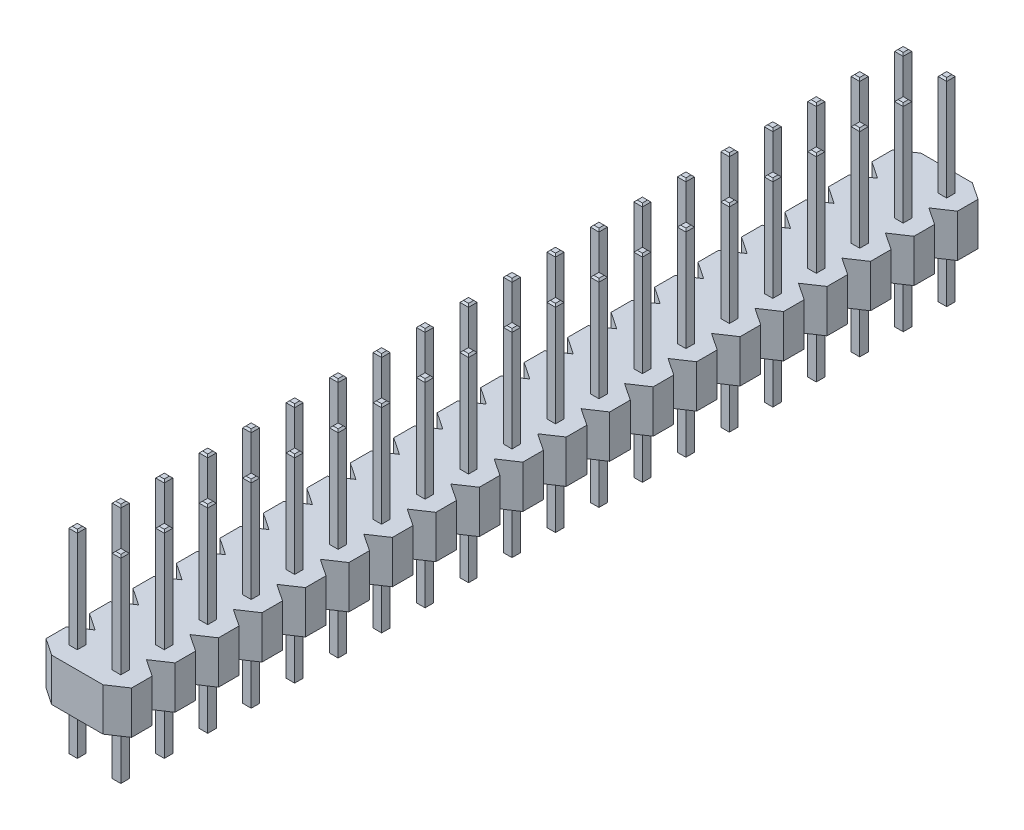
from build123d import *

# Parameters (mm, degrees)
BOSS_EXTRU_1_DEPTH       = 2.5
ENL_V_MAT_EXTRU_1_DEPTH  = 27.903325073
ENL_V_MAT_EXTRU_2_DEPTH  = 27.903325073
ENL_V_MAT_EXTRU_3_DEPTH  = 27.903325073
ENL_V_MAT_EXTRU_4_DEPTH  = 27.903325073
ENL_V_MAT_EXTRU_5_DEPTH  = 27.903325073
ENL_V_MAT_EXTRU_6_DEPTH  = 27.903325073
ENL_V_MAT_EXTRU_7_DEPTH  = 27.903325073
ENL_V_MAT_EXTRU_8_DEPTH  = 27.903325073
ENL_V_MAT_EXTRU_9_DEPTH  = 27.903325073
ENL_V_MAT_EXTRU_10_DEPTH = 27.903325073
ENL_V_MAT_EXTRU_11_DEPTH = 27.903325073
ENL_V_MAT_EXTRU_12_DEPTH = 27.903325073
ENL_V_MAT_EXTRU_13_DEPTH = 27.903325073
ENL_V_MAT_EXTRU_14_DEPTH = 27.903325073
ENL_V_MAT_EXTRU_15_DEPTH = 27.903325073
ENL_V_MAT_EXTRU_16_DEPTH = 27.903325073
ENL_V_MAT_EXTRU_17_DEPTH = 27.903325073
ENL_V_MAT_EXTRU_18_DEPTH = 27.903325073
ENL_V_MAT_EXTRU_19_DEPTH = 27.903325073
ENL_V_MAT_EXTRU_20_DEPTH = 27.903325073
ENL_V_MAT_EXTRU_21_DEPTH = 27.903325073
ENL_V_MAT_EXTRU_22_DEPTH = 27.903325073
ENL_V_MAT_EXTRU_23_DEPTH = 27.903325073
ENL_V_MAT_EXTRU_24_DEPTH = 27.903325073
ENL_V_MAT_EXTRU_25_DEPTH = 27.903325073
ENL_V_MAT_EXTRU_26_DEPTH = 27.903325073
ENL_V_MAT_EXTRU_27_DEPTH = 27.903325073
ENL_V_MAT_EXTRU_28_DEPTH = 27.903325073
ENL_V_MAT_EXTRU_29_DEPTH = 27.903325073
ENL_V_MAT_EXTRU_30_DEPTH = 27.903325073
ENL_V_MAT_EXTRU_31_DEPTH = 27.903325073
ENL_V_MAT_EXTRU_32_DEPTH = 27.903325073
ENL_V_MAT_EXTRU_33_DEPTH = 27.903325073
ENL_V_MAT_EXTRU_34_DEPTH = 27.903325073
ENL_V_MAT_EXTRU_35_DEPTH = 27.903325073
ENL_V_MAT_EXTRU_36_DEPTH = 27.903325073
ENL_V_MAT_EXTRU_37_DEPTH = 27.903325073
ENL_V_MAT_EXTRU_38_DEPTH = 27.903325073
ESQUISSE40_W             = 0.5
ESQUISSE40_H             = 0.5
BOSS_EXTRU_2_DEPTH       = 6
ESQUISSE41_W             = 0.5
ESQUISSE41_H             = 0.5
BOSS_EXTRU_3_DEPTH       = 6
ESQUISSE42_W             = 0.5
ESQUISSE42_H             = 0.5
BOSS_EXTRU_4_DEPTH       = 6
ESQUISSE43_W             = 0.5
ESQUISSE43_H             = 0.5
BOSS_EXTRU_5_DEPTH       = 6
ESQUISSE44_W             = 0.5
ESQUISSE44_H             = 0.5
BOSS_EXTRU_6_DEPTH       = 6
ESQUISSE45_W             = 0.5
ESQUISSE45_H             = 0.5
BOSS_EXTRU_7_DEPTH       = 6
ESQUISSE46_W             = 0.5
ESQUISSE46_H             = 0.5
BOSS_EXTRU_8_DEPTH       = 6
ESQUISSE47_W             = 0.5
ESQUISSE47_H             = 0.5
BOSS_EXTRU_9_DEPTH       = 6
ESQUISSE48_W             = 0.5
ESQUISSE48_H             = 0.5
BOSS_EXTRU_10_DEPTH      = 6
ESQUISSE49_W             = 0.5
ESQUISSE49_H             = 0.5
BOSS_EXTRU_11_DEPTH      = 6
ESQUISSE50_W             = 0.5
ESQUISSE50_H             = 0.5
BOSS_EXTRU_12_DEPTH      = 6
ESQUISSE51_W             = 0.5
ESQUISSE51_H             = 0.5
BOSS_EXTRU_13_DEPTH      = 6
ESQUISSE52_W             = 0.5
ESQUISSE52_H             = 0.5
BOSS_EXTRU_14_DEPTH      = 6
ESQUISSE53_W             = 0.5
ESQUISSE53_H             = 0.5
BOSS_EXTRU_15_DEPTH      = 6
ESQUISSE54_W             = 0.5
ESQUISSE54_H             = 0.5
BOSS_EXTRU_16_DEPTH      = 6
ESQUISSE55_W             = 0.5
ESQUISSE55_H             = 0.5
BOSS_EXTRU_17_DEPTH      = 6
ESQUISSE56_W             = 0.5
ESQUISSE56_H             = 0.5
BOSS_EXTRU_18_DEPTH      = 6
ESQUISSE57_W             = 0.5
ESQUISSE57_H             = 0.5
BOSS_EXTRU_19_DEPTH      = 6
ESQUISSE58_W             = 0.5
ESQUISSE58_H             = 0.5
BOSS_EXTRU_20_DEPTH      = 6
ESQUISSE59_W             = 0.5
ESQUISSE59_H             = 0.5
BOSS_EXTRU_21_DEPTH      = 6
ESQUISSE60_W             = 0.5
ESQUISSE60_H             = 0.5
BOSS_EXTRU_22_DEPTH      = 6
ESQUISSE61_W             = 0.5
ESQUISSE61_H             = 0.5
BOSS_EXTRU_23_DEPTH      = 6
ESQUISSE62_W             = 0.5
ESQUISSE62_H             = 0.5
BOSS_EXTRU_24_DEPTH      = 6
ESQUISSE63_W             = 0.5
ESQUISSE63_H             = 0.5
BOSS_EXTRU_25_DEPTH      = 6
ESQUISSE64_W             = 0.5
ESQUISSE64_H             = 0.5
BOSS_EXTRU_26_DEPTH      = 6
ESQUISSE65_W             = 0.5
ESQUISSE65_H             = 0.5
BOSS_EXTRU_27_DEPTH      = 6
ESQUISSE66_W             = 0.5
ESQUISSE66_H             = 0.5
BOSS_EXTRU_28_DEPTH      = 6
ESQUISSE67_W             = 0.5
ESQUISSE67_H             = 0.5
BOSS_EXTRU_29_DEPTH      = 6
ESQUISSE68_W             = 0.5
ESQUISSE68_H             = 0.5
BOSS_EXTRU_30_DEPTH      = 6
ESQUISSE69_W             = 0.5
ESQUISSE69_H             = 0.5
BOSS_EXTRU_31_DEPTH      = 6
ESQUISSE70_W             = 0.5
ESQUISSE70_H             = 0.5
BOSS_EXTRU_32_DEPTH      = 6
ESQUISSE71_W             = 0.5
ESQUISSE71_H             = 0.5
BOSS_EXTRU_33_DEPTH      = 6
ESQUISSE72_W             = 0.5
ESQUISSE72_H             = 0.5
BOSS_EXTRU_34_DEPTH      = 6
ESQUISSE73_W             = 0.5
ESQUISSE73_H             = 0.5
BOSS_EXTRU_35_DEPTH      = 6
ESQUISSE74_W             = 0.5
ESQUISSE74_H             = 0.5
BOSS_EXTRU_36_DEPTH      = 6
ESQUISSE75_W             = 0.5
ESQUISSE75_H             = 0.5
BOSS_EXTRU_37_DEPTH      = 6
ESQUISSE76_W             = 0.5
ESQUISSE76_H             = 0.5
BOSS_EXTRU_38_DEPTH      = 6
ESQUISSE77_W             = 0.5
ESQUISSE77_H             = 0.5
BOSS_EXTRU_39_DEPTH      = 6
ESQUISSE78_W             = 0.5
ESQUISSE78_H             = 0.5
BOSS_EXTRU_40_DEPTH      = 6
ESQUISSE79_W             = 0.5
ESQUISSE79_H             = 0.5
BOSS_EXTRU_41_DEPTH      = 6
ESQUISSE80_W             = 0.5
ESQUISSE80_H             = 0.5
BOSS_EXTRU_42_DEPTH      = 3
ESQUISSE81_W             = 0.5
ESQUISSE81_H             = 0.5
BOSS_EXTRU_43_DEPTH      = 3
ESQUISSE82_W             = 0.5
ESQUISSE82_H             = 0.5
BOSS_EXTRU_44_DEPTH      = 3
ESQUISSE83_W             = 0.5
ESQUISSE83_H             = 0.5
BOSS_EXTRU_45_DEPTH      = 3
ESQUISSE84_W             = 0.5
ESQUISSE84_H             = 0.5
BOSS_EXTRU_46_DEPTH      = 3
ESQUISSE85_W             = 0.5
ESQUISSE85_H             = 0.5
BOSS_EXTRU_47_DEPTH      = 3
ESQUISSE86_W             = 0.5
ESQUISSE86_H             = 0.5
BOSS_EXTRU_48_DEPTH      = 3
ESQUISSE87_W             = 0.5
ESQUISSE87_H             = 0.5
BOSS_EXTRU_49_DEPTH      = 3
ESQUISSE88_W             = 0.5
ESQUISSE88_H             = 0.5
BOSS_EXTRU_50_DEPTH      = 3
ESQUISSE89_W             = 0.5
ESQUISSE89_H             = 0.5
BOSS_EXTRU_51_DEPTH      = 3
ESQUISSE90_W             = 0.5
ESQUISSE90_H             = 0.5
BOSS_EXTRU_52_DEPTH      = 3
ESQUISSE91_W             = 0.5
ESQUISSE91_H             = 0.5
BOSS_EXTRU_53_DEPTH      = 3
ESQUISSE92_W             = 0.5
ESQUISSE92_H             = 0.5
BOSS_EXTRU_54_DEPTH      = 3
ESQUISSE93_W             = 0.5
ESQUISSE93_H             = 0.5
BOSS_EXTRU_55_DEPTH      = 3
ESQUISSE94_W             = 0.5
ESQUISSE94_H             = 0.5
BOSS_EXTRU_56_DEPTH      = 3
ESQUISSE95_W             = 0.5
ESQUISSE95_H             = 0.5
BOSS_EXTRU_57_DEPTH      = 3
ESQUISSE96_W             = 0.5
ESQUISSE96_H             = 0.5
BOSS_EXTRU_58_DEPTH      = 3
ESQUISSE97_W             = 0.5
ESQUISSE97_H             = 0.5
BOSS_EXTRU_59_DEPTH      = 3
ESQUISSE98_W             = 0.5
ESQUISSE98_H             = 0.5
BOSS_EXTRU_60_DEPTH      = 3
ESQUISSE99_W             = 0.5
ESQUISSE99_H             = 0.5
BOSS_EXTRU_61_DEPTH      = 3
ESQUISSE100_W            = 0.5
ESQUISSE100_H            = 0.5
BOSS_EXTRU_62_DEPTH      = 3
ESQUISSE101_W            = 0.5
ESQUISSE101_H            = 0.5
BOSS_EXTRU_63_DEPTH      = 3
ESQUISSE102_W            = 0.5
ESQUISSE102_H            = 0.5
BOSS_EXTRU_64_DEPTH      = 3
ESQUISSE103_W            = 0.5
ESQUISSE103_H            = 0.5
BOSS_EXTRU_65_DEPTH      = 3
ESQUISSE104_W            = 0.5
ESQUISSE104_H            = 0.5
BOSS_EXTRU_66_DEPTH      = 3
ESQUISSE105_W            = 0.5
ESQUISSE105_H            = 0.5
BOSS_EXTRU_67_DEPTH      = 3
ESQUISSE106_W            = 0.5
ESQUISSE106_H            = 0.5
BOSS_EXTRU_68_DEPTH      = 3
ESQUISSE107_W            = 0.5
ESQUISSE107_H            = 0.5
BOSS_EXTRU_69_DEPTH      = 3
ESQUISSE108_W            = 0.5
ESQUISSE108_H            = 0.5
BOSS_EXTRU_70_DEPTH      = 3
ESQUISSE109_W            = 0.5
ESQUISSE109_H            = 0.5
BOSS_EXTRU_71_DEPTH      = 3
ESQUISSE110_W            = 0.5
ESQUISSE110_H            = 0.5
BOSS_EXTRU_72_DEPTH      = 3
ESQUISSE111_W            = 0.5
ESQUISSE111_H            = 0.5
BOSS_EXTRU_73_DEPTH      = 3
ESQUISSE112_W            = 0.5
ESQUISSE112_H            = 0.5
BOSS_EXTRU_74_DEPTH      = 3
ESQUISSE113_W            = 0.5
ESQUISSE113_H            = 0.5
BOSS_EXTRU_75_DEPTH      = 3
ESQUISSE114_W            = 0.5
ESQUISSE114_H            = 0.5
BOSS_EXTRU_76_DEPTH      = 3
ESQUISSE115_W            = 0.5
ESQUISSE115_H            = 0.5
BOSS_EXTRU_77_DEPTH      = 3
ESQUISSE116_W            = 0.5
ESQUISSE116_H            = 0.5
BOSS_EXTRU_78_DEPTH      = 3
ESQUISSE117_W            = 0.5
ESQUISSE117_H            = 0.5
BOSS_EXTRU_79_DEPTH      = 3
ESQUISSE118_W            = 0.5
ESQUISSE118_H            = 0.5
BOSS_EXTRU_80_DEPTH      = 3
ESQUISSE119_W            = 0.5
ESQUISSE119_H            = 0.5
BOSS_EXTRU_81_DEPTH      = 3
CHANFREIN1_SIZE          = 0.1


with BuildPart() as part:
    # Esquisse1 → Boss.-Extru.1 (new body)
    with BuildSketch(Plane(origin=(0, 2.5, 0), x_dir=(1, 0, 0), z_dir=(0, 1, 0))):
        Polygon((2.5, -23.46), (2.5, 26), (1.5, 26.67), (-1.5, 26.67), (-2.5, 26), (-2.5, -23.46), (-1.5, -24.13), (1.5, -24.13), align=None)
    extrude(amount=-BOSS_EXTRU_1_DEPTH)

    # Esquisse2 → Enlèv. mat.-Extru.1 (cut, through all)
    with BuildSketch(Plane.XZ):
        Polygon((-2.5, 7.02), (-2.5, 5.68), (-1.5, 6.35), align=None)
    extrude(amount=-ENL_V_MAT_EXTRU_1_DEPTH, mode=Mode.SUBTRACT)

    # Esquisse3 → Enlèv. mat.-Extru.2 (cut, through all)
    with BuildSketch(Plane.XZ):
        Polygon((-2.5, 9.56), (-2.5, 8.22), (-1.5, 8.89), align=None)
    extrude(amount=-ENL_V_MAT_EXTRU_2_DEPTH, mode=Mode.SUBTRACT)

    # Esquisse4 → Enlèv. mat.-Extru.3 (cut, through all)
    with BuildSketch(Plane.XZ):
        Polygon((-2.5, 12.1), (-2.5, 10.76), (-1.5, 11.43), align=None)
    extrude(amount=-ENL_V_MAT_EXTRU_3_DEPTH, mode=Mode.SUBTRACT)

    # Esquisse5 → Enlèv. mat.-Extru.4 (cut, through all)
    with BuildSketch(Plane.XZ):
        Polygon((-2.5, 14.64), (-2.5, 13.3), (-1.5, 13.97), align=None)
    extrude(amount=-ENL_V_MAT_EXTRU_4_DEPTH, mode=Mode.SUBTRACT)

    # Esquisse6 → Enlèv. mat.-Extru.5 (cut, through all)
    with BuildSketch(Plane.XZ):
        Polygon((-2.5, 17.18), (-2.5, 15.84), (-1.5, 16.51), align=None)
    extrude(amount=-ENL_V_MAT_EXTRU_5_DEPTH, mode=Mode.SUBTRACT)

    # Esquisse7 → Enlèv. mat.-Extru.6 (cut, through all)
    with BuildSketch(Plane.XZ):
        Polygon((-2.5, 19.72), (-2.5, 18.38), (-1.5, 19.05), align=None)
    extrude(amount=-ENL_V_MAT_EXTRU_6_DEPTH, mode=Mode.SUBTRACT)

    # Esquisse8 → Enlèv. mat.-Extru.7 (cut, through all)
    with BuildSketch(Plane.XZ):
        Polygon((-2.5, 22.26), (-2.5, 20.92), (-1.5, 21.59), align=None)
    extrude(amount=-ENL_V_MAT_EXTRU_7_DEPTH, mode=Mode.SUBTRACT)

    # Esquisse9 → Enlèv. mat.-Extru.8 (cut, through all)
    with BuildSketch(Plane.XZ):
        Polygon((2.5, 20.92), (2.5, 22.26), (1.5, 21.59), align=None)
    extrude(amount=-ENL_V_MAT_EXTRU_8_DEPTH, mode=Mode.SUBTRACT)

    # Esquisse10 → Enlèv. mat.-Extru.9 (cut, through all)
    with BuildSketch(Plane.XZ):
        Polygon((2.5, 18.38), (2.5, 19.72), (1.5, 19.05), align=None)
    extrude(amount=-ENL_V_MAT_EXTRU_9_DEPTH, mode=Mode.SUBTRACT)

    # Esquisse11 → Enlèv. mat.-Extru.10 (cut, through all)
    with BuildSketch(Plane.XZ):
        Polygon((2.5, 15.84), (2.5, 17.18), (1.5, 16.51), align=None)
    extrude(amount=-ENL_V_MAT_EXTRU_10_DEPTH, mode=Mode.SUBTRACT)

    # Esquisse12 → Enlèv. mat.-Extru.11 (cut, through all)
    with BuildSketch(Plane.XZ):
        Polygon((2.5, 13.3), (2.5, 14.64), (1.5, 13.97), align=None)
    extrude(amount=-ENL_V_MAT_EXTRU_11_DEPTH, mode=Mode.SUBTRACT)

    # Esquisse13 → Enlèv. mat.-Extru.12 (cut, through all)
    with BuildSketch(Plane.XZ):
        Polygon((2.5, 10.76), (2.5, 12.1), (1.5, 11.43), align=None)
    extrude(amount=-ENL_V_MAT_EXTRU_12_DEPTH, mode=Mode.SUBTRACT)

    # Esquisse14 → Enlèv. mat.-Extru.13 (cut, through all)
    with BuildSketch(Plane.XZ):
        Polygon((2.5, 8.22), (2.5, 9.56), (1.5, 8.89), align=None)
    extrude(amount=-ENL_V_MAT_EXTRU_13_DEPTH, mode=Mode.SUBTRACT)

    # Esquisse15 → Enlèv. mat.-Extru.14 (cut, through all)
    with BuildSketch(Plane.XZ):
        Polygon((2.5, 5.68), (2.5, 7.02), (1.5, 6.35), align=None)
    extrude(amount=-ENL_V_MAT_EXTRU_14_DEPTH, mode=Mode.SUBTRACT)

    # Esquisse16 → Enlèv. mat.-Extru.15 (cut, through all)
    with BuildSketch(Plane.XZ):
        Polygon((2.5, 3.14), (2.5, 4.48), (1.5, 3.81), align=None)
    extrude(amount=-ENL_V_MAT_EXTRU_15_DEPTH, mode=Mode.SUBTRACT)

    # Esquisse17 → Enlèv. mat.-Extru.16 (cut, through all)
    with BuildSketch(Plane.XZ):
        Polygon((2.5, 0.6), (2.5, 1.94), (1.5, 1.27), align=None)
    extrude(amount=-ENL_V_MAT_EXTRU_16_DEPTH, mode=Mode.SUBTRACT)

    # Esquisse18 → Enlèv. mat.-Extru.17 (cut, through all)
    with BuildSketch(Plane.XZ):
        Polygon((2.5, -1.94), (2.5, -0.6), (1.5, -1.27), align=None)
    extrude(amount=-ENL_V_MAT_EXTRU_17_DEPTH, mode=Mode.SUBTRACT)

    # Esquisse19 → Enlèv. mat.-Extru.18 (cut, through all)
    with BuildSketch(Plane.XZ):
        Polygon((2.5, -4.48), (2.5, -3.14), (1.5, -3.81), align=None)
    extrude(amount=-ENL_V_MAT_EXTRU_18_DEPTH, mode=Mode.SUBTRACT)

    # Esquisse20 → Enlèv. mat.-Extru.19 (cut, through all)
    with BuildSketch(Plane.XZ):
        Polygon((2.5, -7.02), (2.5, -5.68), (1.5, -6.35), align=None)
    extrude(amount=-ENL_V_MAT_EXTRU_19_DEPTH, mode=Mode.SUBTRACT)

    # Esquisse21 → Enlèv. mat.-Extru.20 (cut, through all)
    with BuildSketch(Plane.XZ):
        Polygon((2.5, -9.56), (2.5, -8.22), (1.5, -8.89), align=None)
    extrude(amount=-ENL_V_MAT_EXTRU_20_DEPTH, mode=Mode.SUBTRACT)

    # Esquisse22 → Enlèv. mat.-Extru.21 (cut, through all)
    with BuildSketch(Plane.XZ):
        Polygon((2.5, -12.1), (2.5, -10.76), (1.5, -11.43), align=None)
    extrude(amount=-ENL_V_MAT_EXTRU_21_DEPTH, mode=Mode.SUBTRACT)

    # Esquisse23 → Enlèv. mat.-Extru.22 (cut, through all)
    with BuildSketch(Plane.XZ):
        Polygon((2.5, -14.64), (2.5, -13.3), (1.5, -13.97), align=None)
    extrude(amount=-ENL_V_MAT_EXTRU_22_DEPTH, mode=Mode.SUBTRACT)

    # Esquisse24 → Enlèv. mat.-Extru.23 (cut, through all)
    with BuildSketch(Plane.XZ):
        Polygon((2.5, -17.18), (2.5, -15.84), (1.5, -16.51), align=None)
    extrude(amount=-ENL_V_MAT_EXTRU_23_DEPTH, mode=Mode.SUBTRACT)

    # Esquisse25 → Enlèv. mat.-Extru.24 (cut, through all)
    with BuildSketch(Plane.XZ):
        Polygon((2.5, -19.72), (2.5, -18.38), (1.5, -19.05), align=None)
    extrude(amount=-ENL_V_MAT_EXTRU_24_DEPTH, mode=Mode.SUBTRACT)

    # Esquisse26 → Enlèv. mat.-Extru.25 (cut, through all)
    with BuildSketch(Plane.XZ):
        Polygon((2.5, -22.26), (2.5, -20.92), (1.5, -21.59), align=None)
    extrude(amount=-ENL_V_MAT_EXTRU_25_DEPTH, mode=Mode.SUBTRACT)

    # Esquisse27 → Enlèv. mat.-Extru.26 (cut, through all)
    with BuildSketch(Plane.XZ):
        Polygon((2.5, -24.8), (2.5, -23.46), (1.5, -24.13), align=None)
    extrude(amount=-ENL_V_MAT_EXTRU_26_DEPTH, mode=Mode.SUBTRACT)

    # Esquisse28 → Enlèv. mat.-Extru.27 (cut, through all)
    with BuildSketch(Plane.XZ):
        Polygon((-2.5, -23.46), (-2.5, -24.8), (-1.5, -24.13), align=None)
    extrude(amount=-ENL_V_MAT_EXTRU_27_DEPTH, mode=Mode.SUBTRACT)

    # Esquisse29 → Enlèv. mat.-Extru.28 (cut, through all)
    with BuildSketch(Plane.XZ):
        Polygon((-2.5, -20.92), (-2.5, -22.26), (-1.5, -21.59), align=None)
    extrude(amount=-ENL_V_MAT_EXTRU_28_DEPTH, mode=Mode.SUBTRACT)

    # Esquisse30 → Enlèv. mat.-Extru.29 (cut, through all)
    with BuildSketch(Plane.XZ):
        Polygon((-2.5, -18.38), (-2.5, -19.72), (-1.5, -19.05), align=None)
    extrude(amount=-ENL_V_MAT_EXTRU_29_DEPTH, mode=Mode.SUBTRACT)

    # Esquisse31 → Enlèv. mat.-Extru.30 (cut, through all)
    with BuildSketch(Plane.XZ):
        Polygon((-2.5, -15.84), (-2.5, -17.18), (-1.5, -16.51), align=None)
    extrude(amount=-ENL_V_MAT_EXTRU_30_DEPTH, mode=Mode.SUBTRACT)

    # Esquisse32 → Enlèv. mat.-Extru.31 (cut, through all)
    with BuildSketch(Plane.XZ):
        Polygon((-2.5, -13.3), (-2.5, -14.64), (-1.5, -13.97), align=None)
    extrude(amount=-ENL_V_MAT_EXTRU_31_DEPTH, mode=Mode.SUBTRACT)

    # Esquisse33 → Enlèv. mat.-Extru.32 (cut, through all)
    with BuildSketch(Plane.XZ):
        Polygon((-2.5, -10.76), (-2.5, -12.1), (-1.5, -11.43), align=None)
    extrude(amount=-ENL_V_MAT_EXTRU_32_DEPTH, mode=Mode.SUBTRACT)

    # Esquisse34 → Enlèv. mat.-Extru.33 (cut, through all)
    with BuildSketch(Plane.XZ):
        Polygon((-2.5, -8.22), (-2.5, -9.56), (-1.5, -8.89), align=None)
    extrude(amount=-ENL_V_MAT_EXTRU_33_DEPTH, mode=Mode.SUBTRACT)

    # Esquisse35 → Enlèv. mat.-Extru.34 (cut, through all)
    with BuildSketch(Plane.XZ):
        Polygon((-2.5, -5.68), (-2.5, -7.02), (-1.5, -6.35), align=None)
    extrude(amount=-ENL_V_MAT_EXTRU_34_DEPTH, mode=Mode.SUBTRACT)

    # Esquisse36 → Enlèv. mat.-Extru.35 (cut, through all)
    with BuildSketch(Plane.XZ):
        Polygon((-2.5, -3.14), (-2.5, -4.48), (-1.5, -3.81), align=None)
    extrude(amount=-ENL_V_MAT_EXTRU_35_DEPTH, mode=Mode.SUBTRACT)

    # Esquisse37 → Enlèv. mat.-Extru.36 (cut, through all)
    with BuildSketch(Plane.XZ):
        Polygon((-2.5, -0.6), (-2.5, -1.94), (-1.5, -1.27), align=None)
    extrude(amount=-ENL_V_MAT_EXTRU_36_DEPTH, mode=Mode.SUBTRACT)

    # Esquisse38 → Enlèv. mat.-Extru.37 (cut, through all)
    with BuildSketch(Plane.XZ):
        Polygon((-2.5, 1.94), (-2.5, 0.6), (-1.5, 1.27), align=None)
    extrude(amount=-ENL_V_MAT_EXTRU_37_DEPTH, mode=Mode.SUBTRACT)

    # Esquisse39 → Enlèv. mat.-Extru.38 (cut, through all)
    with BuildSketch(Plane.XZ):
        Polygon((-2.5, 4.48), (-2.5, 3.14), (-1.5, 3.81), align=None)
    extrude(amount=-ENL_V_MAT_EXTRU_38_DEPTH, mode=Mode.SUBTRACT)

    # Esquisse40 → Boss.-Extru.2 (add)
    with BuildSketch(Plane(origin=(0, 2.5, 0), x_dir=(-1, 0, 0), z_dir=(0, 1, 0))):
        with Locations((1.27, -2.54)):
            Rectangle(ESQUISSE40_W, ESQUISSE40_H)
    extrude(amount=BOSS_EXTRU_2_DEPTH)

    # Esquisse41 → Boss.-Extru.3 (add)
    with BuildSketch(Plane(origin=(0, 2.5, 0), x_dir=(-1, 0, 0), z_dir=(0, 1, 0))):
        with Locations((-1.27, -2.54)):
            Rectangle(ESQUISSE41_W, ESQUISSE41_H)
    extrude(amount=BOSS_EXTRU_3_DEPTH)

    # Esquisse42 → Boss.-Extru.4 (add)
    with BuildSketch(Plane(origin=(0, 2.5, 0), x_dir=(-1, 0, 0), z_dir=(0, 1, 0))):
        with Locations((-1.27, -5.08)):
            Rectangle(ESQUISSE42_W, ESQUISSE42_H)
    extrude(amount=BOSS_EXTRU_4_DEPTH)

    # Esquisse43 → Boss.-Extru.5 (add)
    with BuildSketch(Plane(origin=(0, 2.5, 0), x_dir=(-1, 0, 0), z_dir=(0, 1, 0))):
        with Locations((1.27, -5.08)):
            Rectangle(ESQUISSE43_W, ESQUISSE43_H)
    extrude(amount=BOSS_EXTRU_5_DEPTH)

    # Esquisse44 → Boss.-Extru.6 (add)
    with BuildSketch(Plane(origin=(0, 2.5, 0), x_dir=(-1, 0, 0), z_dir=(0, 1, 0))):
        with Locations((-1.27, -7.62)):
            Rectangle(ESQUISSE44_W, ESQUISSE44_H)
    extrude(amount=BOSS_EXTRU_6_DEPTH)

    # Esquisse45 → Boss.-Extru.7 (add)
    with BuildSketch(Plane(origin=(0, 2.5, 0), x_dir=(-1, 0, 0), z_dir=(0, 1, 0))):
        with Locations((1.27, -7.62)):
            Rectangle(ESQUISSE45_W, ESQUISSE45_H)
    extrude(amount=BOSS_EXTRU_7_DEPTH)

    # Esquisse46 → Boss.-Extru.8 (add)
    with BuildSketch(Plane(origin=(0, 2.5, 0), x_dir=(-1, 0, 0), z_dir=(0, 1, 0))):
        with Locations((-1.27, -10.16)):
            Rectangle(ESQUISSE46_W, ESQUISSE46_H)
    extrude(amount=BOSS_EXTRU_8_DEPTH)

    # Esquisse47 → Boss.-Extru.9 (add)
    with BuildSketch(Plane(origin=(0, 2.5, 0), x_dir=(-1, 0, 0), z_dir=(0, 1, 0))):
        with Locations((1.27, -10.16)):
            Rectangle(ESQUISSE47_W, ESQUISSE47_H)
    extrude(amount=BOSS_EXTRU_9_DEPTH)

    # Esquisse48 → Boss.-Extru.10 (add)
    with BuildSketch(Plane(origin=(0, 2.5, 0), x_dir=(-1, 0, 0), z_dir=(0, 1, 0))):
        with Locations((-1.27, -12.7)):
            Rectangle(ESQUISSE48_W, ESQUISSE48_H)
    extrude(amount=BOSS_EXTRU_10_DEPTH)

    # Esquisse49 → Boss.-Extru.11 (add)
    with BuildSketch(Plane(origin=(0, 2.5, 0), x_dir=(-1, 0, 0), z_dir=(0, 1, 0))):
        with Locations((1.27, -12.7)):
            Rectangle(ESQUISSE49_W, ESQUISSE49_H)
    extrude(amount=BOSS_EXTRU_11_DEPTH)

    # Esquisse50 → Boss.-Extru.12 (add)
    with BuildSketch(Plane(origin=(0, 2.5, 0), x_dir=(-1, 0, 0), z_dir=(0, 1, 0))):
        with Locations((-1.27, -15.24)):
            Rectangle(ESQUISSE50_W, ESQUISSE50_H)
    extrude(amount=BOSS_EXTRU_12_DEPTH)

    # Esquisse51 → Boss.-Extru.13 (add)
    with BuildSketch(Plane(origin=(0, 2.5, 0), x_dir=(-1, 0, 0), z_dir=(0, 1, 0))):
        with Locations((1.27, -15.24)):
            Rectangle(ESQUISSE51_W, ESQUISSE51_H)
    extrude(amount=BOSS_EXTRU_13_DEPTH)

    # Esquisse52 → Boss.-Extru.14 (add)
    with BuildSketch(Plane(origin=(0, 2.5, 0), x_dir=(-1, 0, 0), z_dir=(0, 1, 0))):
        with Locations((-1.27, -17.78)):
            Rectangle(ESQUISSE52_W, ESQUISSE52_H)
    extrude(amount=BOSS_EXTRU_14_DEPTH)

    # Esquisse53 → Boss.-Extru.15 (add)
    with BuildSketch(Plane(origin=(0, 2.5, 0), x_dir=(-1, 0, 0), z_dir=(0, 1, 0))):
        with Locations((1.27, -17.78)):
            Rectangle(ESQUISSE53_W, ESQUISSE53_H)
    extrude(amount=BOSS_EXTRU_15_DEPTH)

    # Esquisse54 → Boss.-Extru.16 (add)
    with BuildSketch(Plane(origin=(0, 2.5, 0), x_dir=(-1, 0, 0), z_dir=(0, 1, 0))):
        with Locations((-1.27, -20.32)):
            Rectangle(ESQUISSE54_W, ESQUISSE54_H)
    extrude(amount=BOSS_EXTRU_16_DEPTH)

    # Esquisse55 → Boss.-Extru.17 (add)
    with BuildSketch(Plane(origin=(0, 2.5, 0), x_dir=(-1, 0, 0), z_dir=(0, 1, 0))):
        with Locations((1.27, -20.32)):
            Rectangle(ESQUISSE55_W, ESQUISSE55_H)
    extrude(amount=BOSS_EXTRU_17_DEPTH)

    # Esquisse56 → Boss.-Extru.18 (add)
    with BuildSketch(Plane(origin=(0, 2.5, 0), x_dir=(-1, 0, 0), z_dir=(0, 1, 0))):
        with Locations((-1.27, -22.86)):
            Rectangle(ESQUISSE56_W, ESQUISSE56_H)
    extrude(amount=BOSS_EXTRU_18_DEPTH)

    # Esquisse57 → Boss.-Extru.19 (add)
    with BuildSketch(Plane(origin=(0, 2.5, 0), x_dir=(-1, 0, 0), z_dir=(0, 1, 0))):
        with Locations((1.27, -22.86)):
            Rectangle(ESQUISSE57_W, ESQUISSE57_H)
    extrude(amount=BOSS_EXTRU_19_DEPTH)

    # Esquisse58 → Boss.-Extru.20 (add)
    with BuildSketch(Plane(origin=(0, 2.5, 0), x_dir=(-1, 0, 0), z_dir=(0, 1, 0))):
        with Locations((-1.27, -25.4)):
            Rectangle(ESQUISSE58_W, ESQUISSE58_H)
    extrude(amount=BOSS_EXTRU_20_DEPTH)

    # Esquisse59 → Boss.-Extru.21 (add)
    with BuildSketch(Plane(origin=(0, 2.5, 0), x_dir=(-1, 0, 0), z_dir=(0, 1, 0))):
        with Locations((1.27, -25.4)):
            Rectangle(ESQUISSE59_W, ESQUISSE59_H)
    extrude(amount=BOSS_EXTRU_21_DEPTH)

    # Esquisse60 → Boss.-Extru.22 (add)
    with BuildSketch(Plane(origin=(0, 2.5, 0), x_dir=(-1, 0, 0), z_dir=(0, 1, 0))):
        with Locations((1.27, 22.86)):
            Rectangle(ESQUISSE60_W, ESQUISSE60_H)
    extrude(amount=BOSS_EXTRU_22_DEPTH)

    # Esquisse61 → Boss.-Extru.23 (add)
    with BuildSketch(Plane(origin=(0, 2.5, 0), x_dir=(-1, 0, 0), z_dir=(0, 1, 0))):
        with Locations((-1.27, 22.86)):
            Rectangle(ESQUISSE61_W, ESQUISSE61_H)
    extrude(amount=BOSS_EXTRU_23_DEPTH)

    # Esquisse62 → Boss.-Extru.24 (add)
    with BuildSketch(Plane(origin=(0, 2.5, 0), x_dir=(-1, 0, 0), z_dir=(0, 1, 0))):
        with Locations((-1.27, 20.32)):
            Rectangle(ESQUISSE62_W, ESQUISSE62_H)
    extrude(amount=BOSS_EXTRU_24_DEPTH)

    # Esquisse63 → Boss.-Extru.25 (add)
    with BuildSketch(Plane(origin=(0, 2.5, 0), x_dir=(-1, 0, 0), z_dir=(0, 1, 0))):
        with Locations((1.27, 20.32)):
            Rectangle(ESQUISSE63_W, ESQUISSE63_H)
    extrude(amount=BOSS_EXTRU_25_DEPTH)

    # Esquisse64 → Boss.-Extru.26 (add)
    with BuildSketch(Plane(origin=(0, 2.5, 0), x_dir=(-1, 0, 0), z_dir=(0, 1, 0))):
        with Locations((-1.27, 17.78)):
            Rectangle(ESQUISSE64_W, ESQUISSE64_H)
    extrude(amount=BOSS_EXTRU_26_DEPTH)

    # Esquisse65 → Boss.-Extru.27 (add)
    with BuildSketch(Plane(origin=(0, 2.5, 0), x_dir=(-1, 0, 0), z_dir=(0, 1, 0))):
        with Locations((1.27, 17.78)):
            Rectangle(ESQUISSE65_W, ESQUISSE65_H)
    extrude(amount=BOSS_EXTRU_27_DEPTH)

    # Esquisse66 → Boss.-Extru.28 (add)
    with BuildSketch(Plane(origin=(0, 2.5, 0), x_dir=(-1, 0, 0), z_dir=(0, 1, 0))):
        with Locations((-1.27, 15.24)):
            Rectangle(ESQUISSE66_W, ESQUISSE66_H)
    extrude(amount=BOSS_EXTRU_28_DEPTH)

    # Esquisse67 → Boss.-Extru.29 (add)
    with BuildSketch(Plane(origin=(0, 2.5, 0), x_dir=(-1, 0, 0), z_dir=(0, 1, 0))):
        with Locations((1.27, 15.24)):
            Rectangle(ESQUISSE67_W, ESQUISSE67_H)
    extrude(amount=BOSS_EXTRU_29_DEPTH)

    # Esquisse68 → Boss.-Extru.30 (add)
    with BuildSketch(Plane(origin=(0, 2.5, 0), x_dir=(-1, 0, 0), z_dir=(0, 1, 0))):
        with Locations((-1.27, 12.7)):
            Rectangle(ESQUISSE68_W, ESQUISSE68_H)
    extrude(amount=BOSS_EXTRU_30_DEPTH)

    # Esquisse69 → Boss.-Extru.31 (add)
    with BuildSketch(Plane(origin=(0, 2.5, 0), x_dir=(-1, 0, 0), z_dir=(0, 1, 0))):
        with Locations((1.27, 12.7)):
            Rectangle(ESQUISSE69_W, ESQUISSE69_H)
    extrude(amount=BOSS_EXTRU_31_DEPTH)

    # Esquisse70 → Boss.-Extru.32 (add)
    with BuildSketch(Plane(origin=(0, 2.5, 0), x_dir=(-1, 0, 0), z_dir=(0, 1, 0))):
        with Locations((-1.27, 10.16)):
            Rectangle(ESQUISSE70_W, ESQUISSE70_H)
    extrude(amount=BOSS_EXTRU_32_DEPTH)

    # Esquisse71 → Boss.-Extru.33 (add)
    with BuildSketch(Plane(origin=(0, 2.5, 0), x_dir=(-1, 0, 0), z_dir=(0, 1, 0))):
        with Locations((1.27, 10.16)):
            Rectangle(ESQUISSE71_W, ESQUISSE71_H)
    extrude(amount=BOSS_EXTRU_33_DEPTH)

    # Esquisse72 → Boss.-Extru.34 (add)
    with BuildSketch(Plane(origin=(0, 2.5, 0), x_dir=(-1, 0, 0), z_dir=(0, 1, 0))):
        with Locations((-1.27, 7.62)):
            Rectangle(ESQUISSE72_W, ESQUISSE72_H)
    extrude(amount=BOSS_EXTRU_34_DEPTH)

    # Esquisse73 → Boss.-Extru.35 (add)
    with BuildSketch(Plane(origin=(0, 2.5, 0), x_dir=(-1, 0, 0), z_dir=(0, 1, 0))):
        with Locations((1.27, 7.62)):
            Rectangle(ESQUISSE73_W, ESQUISSE73_H)
    extrude(amount=BOSS_EXTRU_35_DEPTH)

    # Esquisse74 → Boss.-Extru.36 (add)
    with BuildSketch(Plane(origin=(0, 2.5, 0), x_dir=(-1, 0, 0), z_dir=(0, 1, 0))):
        with Locations((-1.27, 5.08)):
            Rectangle(ESQUISSE74_W, ESQUISSE74_H)
    extrude(amount=BOSS_EXTRU_36_DEPTH)

    # Esquisse75 → Boss.-Extru.37 (add)
    with BuildSketch(Plane(origin=(0, 2.5, 0), x_dir=(-1, 0, 0), z_dir=(0, 1, 0))):
        with Locations((1.27, 5.08)):
            Rectangle(ESQUISSE75_W, ESQUISSE75_H)
    extrude(amount=BOSS_EXTRU_37_DEPTH)

    # Esquisse76 → Boss.-Extru.38 (add)
    with BuildSketch(Plane(origin=(0, 2.5, 0), x_dir=(-1, 0, 0), z_dir=(0, 1, 0))):
        with Locations((-1.27, 2.54)):
            Rectangle(ESQUISSE76_W, ESQUISSE76_H)
    extrude(amount=BOSS_EXTRU_38_DEPTH)

    # Esquisse77 → Boss.-Extru.39 (add)
    with BuildSketch(Plane(origin=(0, 2.5, 0), x_dir=(-1, 0, 0), z_dir=(0, 1, 0))):
        with Locations((1.27, 2.54)):
            Rectangle(ESQUISSE77_W, ESQUISSE77_H)
    extrude(amount=BOSS_EXTRU_39_DEPTH)

    # Esquisse78 → Boss.-Extru.40 (add)
    with BuildSketch(Plane(origin=(0, 2.5, 0), x_dir=(-1, 0, 0), z_dir=(0, 1, 0))):
        with Locations((-1.27, 0)):
            Rectangle(ESQUISSE78_W, ESQUISSE78_H)
    extrude(amount=BOSS_EXTRU_40_DEPTH)

    # Esquisse79 → Boss.-Extru.41 (add)
    with BuildSketch(Plane(origin=(0, 2.5, 0), x_dir=(-1, 0, 0), z_dir=(0, 1, 0))):
        with Locations((1.27, 0)):
            Rectangle(ESQUISSE79_W, ESQUISSE79_H)
    extrude(amount=BOSS_EXTRU_41_DEPTH)

    # Esquisse80 → Boss.-Extru.42 (add)
    with BuildSketch(Plane.XZ):
        with Locations((-1.27, -2.54)):
            Rectangle(ESQUISSE80_W, ESQUISSE80_H)
    extrude(amount=BOSS_EXTRU_42_DEPTH)

    # Esquisse81 → Boss.-Extru.43 (add)
    with BuildSketch(Plane.XZ):
        with Locations((1.27, -2.54)):
            Rectangle(ESQUISSE81_W, ESQUISSE81_H)
    extrude(amount=BOSS_EXTRU_43_DEPTH)

    # Esquisse82 → Boss.-Extru.44 (add)
    with BuildSketch(Plane.XZ):
        with Locations((1.27, -5.08)):
            Rectangle(ESQUISSE82_W, ESQUISSE82_H)
    extrude(amount=BOSS_EXTRU_44_DEPTH)

    # Esquisse83 → Boss.-Extru.45 (add)
    with BuildSketch(Plane.XZ):
        with Locations((-1.27, -5.08)):
            Rectangle(ESQUISSE83_W, ESQUISSE83_H)
    extrude(amount=BOSS_EXTRU_45_DEPTH)

    # Esquisse84 → Boss.-Extru.46 (add)
    with BuildSketch(Plane.XZ):
        with Locations((1.27, -7.62)):
            Rectangle(ESQUISSE84_W, ESQUISSE84_H)
    extrude(amount=BOSS_EXTRU_46_DEPTH)

    # Esquisse85 → Boss.-Extru.47 (add)
    with BuildSketch(Plane.XZ):
        with Locations((-1.27, -7.62)):
            Rectangle(ESQUISSE85_W, ESQUISSE85_H)
    extrude(amount=BOSS_EXTRU_47_DEPTH)

    # Esquisse86 → Boss.-Extru.48 (add)
    with BuildSketch(Plane.XZ):
        with Locations((1.27, -10.16)):
            Rectangle(ESQUISSE86_W, ESQUISSE86_H)
    extrude(amount=BOSS_EXTRU_48_DEPTH)

    # Esquisse87 → Boss.-Extru.49 (add)
    with BuildSketch(Plane.XZ):
        with Locations((-1.27, -10.16)):
            Rectangle(ESQUISSE87_W, ESQUISSE87_H)
    extrude(amount=BOSS_EXTRU_49_DEPTH)

    # Esquisse88 → Boss.-Extru.50 (add)
    with BuildSketch(Plane.XZ):
        with Locations((1.27, -12.7)):
            Rectangle(ESQUISSE88_W, ESQUISSE88_H)
    extrude(amount=BOSS_EXTRU_50_DEPTH)

    # Esquisse89 → Boss.-Extru.51 (add)
    with BuildSketch(Plane.XZ):
        with Locations((-1.27, -12.7)):
            Rectangle(ESQUISSE89_W, ESQUISSE89_H)
    extrude(amount=BOSS_EXTRU_51_DEPTH)

    # Esquisse90 → Boss.-Extru.52 (add)
    with BuildSketch(Plane.XZ):
        with Locations((1.27, -15.24)):
            Rectangle(ESQUISSE90_W, ESQUISSE90_H)
    extrude(amount=BOSS_EXTRU_52_DEPTH)

    # Esquisse91 → Boss.-Extru.53 (add)
    with BuildSketch(Plane.XZ):
        with Locations((-1.27, -15.24)):
            Rectangle(ESQUISSE91_W, ESQUISSE91_H)
    extrude(amount=BOSS_EXTRU_53_DEPTH)

    # Esquisse92 → Boss.-Extru.54 (add)
    with BuildSketch(Plane.XZ):
        with Locations((1.27, -17.78)):
            Rectangle(ESQUISSE92_W, ESQUISSE92_H)
    extrude(amount=BOSS_EXTRU_54_DEPTH)

    # Esquisse93 → Boss.-Extru.55 (add)
    with BuildSketch(Plane.XZ):
        with Locations((-1.27, -17.78)):
            Rectangle(ESQUISSE93_W, ESQUISSE93_H)
    extrude(amount=BOSS_EXTRU_55_DEPTH)

    # Esquisse94 → Boss.-Extru.56 (add)
    with BuildSketch(Plane.XZ):
        with Locations((1.27, -20.32)):
            Rectangle(ESQUISSE94_W, ESQUISSE94_H)
    extrude(amount=BOSS_EXTRU_56_DEPTH)

    # Esquisse95 → Boss.-Extru.57 (add)
    with BuildSketch(Plane.XZ):
        with Locations((-1.27, -20.32)):
            Rectangle(ESQUISSE95_W, ESQUISSE95_H)
    extrude(amount=BOSS_EXTRU_57_DEPTH)

    # Esquisse96 → Boss.-Extru.58 (add)
    with BuildSketch(Plane.XZ):
        with Locations((1.27, -22.86)):
            Rectangle(ESQUISSE96_W, ESQUISSE96_H)
    extrude(amount=BOSS_EXTRU_58_DEPTH)

    # Esquisse97 → Boss.-Extru.59 (add)
    with BuildSketch(Plane.XZ):
        with Locations((-1.27, -22.86)):
            Rectangle(ESQUISSE97_W, ESQUISSE97_H)
    extrude(amount=BOSS_EXTRU_59_DEPTH)

    # Esquisse98 → Boss.-Extru.60 (add)
    with BuildSketch(Plane.XZ):
        with Locations((1.27, -25.4)):
            Rectangle(ESQUISSE98_W, ESQUISSE98_H)
    extrude(amount=BOSS_EXTRU_60_DEPTH)

    # Esquisse99 → Boss.-Extru.61 (add)
    with BuildSketch(Plane.XZ):
        with Locations((-1.27, -25.4)):
            Rectangle(ESQUISSE99_W, ESQUISSE99_H)
    extrude(amount=BOSS_EXTRU_61_DEPTH)

    # Esquisse100 → Boss.-Extru.62 (add)
    with BuildSketch(Plane.XZ):
        with Locations((-1.27, 22.86)):
            Rectangle(ESQUISSE100_W, ESQUISSE100_H)
    extrude(amount=BOSS_EXTRU_62_DEPTH)

    # Esquisse101 → Boss.-Extru.63 (add)
    with BuildSketch(Plane.XZ):
        with Locations((1.27, 22.86)):
            Rectangle(ESQUISSE101_W, ESQUISSE101_H)
    extrude(amount=BOSS_EXTRU_63_DEPTH)

    # Esquisse102 → Boss.-Extru.64 (add)
    with BuildSketch(Plane.XZ):
        with Locations((1.27, 20.32)):
            Rectangle(ESQUISSE102_W, ESQUISSE102_H)
    extrude(amount=BOSS_EXTRU_64_DEPTH)

    # Esquisse103 → Boss.-Extru.65 (add)
    with BuildSketch(Plane.XZ):
        with Locations((-1.27, 20.32)):
            Rectangle(ESQUISSE103_W, ESQUISSE103_H)
    extrude(amount=BOSS_EXTRU_65_DEPTH)

    # Esquisse104 → Boss.-Extru.66 (add)
    with BuildSketch(Plane.XZ):
        with Locations((1.27, 17.78)):
            Rectangle(ESQUISSE104_W, ESQUISSE104_H)
    extrude(amount=BOSS_EXTRU_66_DEPTH)

    # Esquisse105 → Boss.-Extru.67 (add)
    with BuildSketch(Plane.XZ):
        with Locations((-1.27, 17.78)):
            Rectangle(ESQUISSE105_W, ESQUISSE105_H)
    extrude(amount=BOSS_EXTRU_67_DEPTH)

    # Esquisse106 → Boss.-Extru.68 (add)
    with BuildSketch(Plane.XZ):
        with Locations((1.27, 15.24)):
            Rectangle(ESQUISSE106_W, ESQUISSE106_H)
    extrude(amount=BOSS_EXTRU_68_DEPTH)

    # Esquisse107 → Boss.-Extru.69 (add)
    with BuildSketch(Plane.XZ):
        with Locations((-1.27, 15.24)):
            Rectangle(ESQUISSE107_W, ESQUISSE107_H)
    extrude(amount=BOSS_EXTRU_69_DEPTH)

    # Esquisse108 → Boss.-Extru.70 (add)
    with BuildSketch(Plane.XZ):
        with Locations((1.27, 12.7)):
            Rectangle(ESQUISSE108_W, ESQUISSE108_H)
    extrude(amount=BOSS_EXTRU_70_DEPTH)

    # Esquisse109 → Boss.-Extru.71 (add)
    with BuildSketch(Plane.XZ):
        with Locations((-1.27, 12.7)):
            Rectangle(ESQUISSE109_W, ESQUISSE109_H)
    extrude(amount=BOSS_EXTRU_71_DEPTH)

    # Esquisse110 → Boss.-Extru.72 (add)
    with BuildSketch(Plane.XZ):
        with Locations((1.27, 10.16)):
            Rectangle(ESQUISSE110_W, ESQUISSE110_H)
    extrude(amount=BOSS_EXTRU_72_DEPTH)

    # Esquisse111 → Boss.-Extru.73 (add)
    with BuildSketch(Plane.XZ):
        with Locations((-1.27, 10.16)):
            Rectangle(ESQUISSE111_W, ESQUISSE111_H)
    extrude(amount=BOSS_EXTRU_73_DEPTH)

    # Esquisse112 → Boss.-Extru.74 (add)
    with BuildSketch(Plane.XZ):
        with Locations((1.27, 7.62)):
            Rectangle(ESQUISSE112_W, ESQUISSE112_H)
    extrude(amount=BOSS_EXTRU_74_DEPTH)

    # Esquisse113 → Boss.-Extru.75 (add)
    with BuildSketch(Plane.XZ):
        with Locations((-1.27, 7.62)):
            Rectangle(ESQUISSE113_W, ESQUISSE113_H)
    extrude(amount=BOSS_EXTRU_75_DEPTH)

    # Esquisse114 → Boss.-Extru.76 (add)
    with BuildSketch(Plane.XZ):
        with Locations((1.27, 5.08)):
            Rectangle(ESQUISSE114_W, ESQUISSE114_H)
    extrude(amount=BOSS_EXTRU_76_DEPTH)

    # Esquisse115 → Boss.-Extru.77 (add)
    with BuildSketch(Plane.XZ):
        with Locations((-1.27, 5.08)):
            Rectangle(ESQUISSE115_W, ESQUISSE115_H)
    extrude(amount=BOSS_EXTRU_77_DEPTH)

    # Esquisse116 → Boss.-Extru.78 (add)
    with BuildSketch(Plane.XZ):
        with Locations((1.27, 2.54)):
            Rectangle(ESQUISSE116_W, ESQUISSE116_H)
    extrude(amount=BOSS_EXTRU_78_DEPTH)

    # Esquisse117 → Boss.-Extru.79 (add)
    with BuildSketch(Plane.XZ):
        with Locations((-1.27, 2.54)):
            Rectangle(ESQUISSE117_W, ESQUISSE117_H)
    extrude(amount=BOSS_EXTRU_79_DEPTH)

    # Esquisse118 → Boss.-Extru.80 (add)
    with BuildSketch(Plane.XZ):
        with Locations((1.27, 0)):
            Rectangle(ESQUISSE118_W, ESQUISSE118_H)
    extrude(amount=BOSS_EXTRU_80_DEPTH)

    # Esquisse119 → Boss.-Extru.81 (add)
    with BuildSketch(Plane.XZ):
        with Locations((-1.27, 0)):
            Rectangle(ESQUISSE119_W, ESQUISSE119_H)
    extrude(amount=BOSS_EXTRU_81_DEPTH)

    # Chanfrein1
    chanfrein1_edges = [part.edges().sort_by_distance(p)[0] for p in [
        (1.02, 8.5, 0),
        (1.27, 8.5, 0.25),
        (1.52, 8.5, 0),
        (1.27, 8.5, -0.25),
        (-1.27, 8.5, 0.25),
        (-1.02, 8.5, 0),
        (-1.27, 8.5, -0.25),
        (-1.52, 8.5, 0),
        (-1.02, 8.5, -2.54),
        (-1.27, 8.5, -2.79),
        (-1.52, 8.5, -2.54),
        (-1.27, 8.5, -2.29),
        (1.27, 8.5, -2.79),
        (1.02, 8.5, -2.54),
        (1.27, 8.5, -2.29),
        (1.52, 8.5, -2.54),
        (1.27, 8.5, -5.33),
        (1.02, 8.5, -5.08),
        (1.27, 8.5, -4.83),
        (1.52, 8.5, -5.08),
        (-1.27, 8.5, -5.33),
        (-1.52, 8.5, -5.08),
        (-1.27, 8.5, -4.83),
        (-1.02, 8.5, -5.08),
        (1.27, 8.5, -7.87),
        (1.02, 8.5, -7.62),
        (1.27, 8.5, -7.37),
        (1.52, 8.5, -7.62),
        (-1.27, 8.5, -7.87),
        (-1.52, 8.5, -7.62),
        (-1.27, 8.5, -7.37),
        (-1.02, 8.5, -7.62),
        (1.27, 8.5, -10.41),
        (1.02, 8.5, -10.16),
        (1.27, 8.5, -9.91),
        (1.52, 8.5, -10.16),
        (-1.27, 8.5, -9.91),
        (-1.02, 8.5, -10.16),
        (-1.27, 8.5, -10.41),
        (-1.52, 8.5, -10.16),
        (1.27, 8.5, -12.95),
        (1.02, 8.5, -12.7),
        (1.27, 8.5, -12.45),
        (1.52, 8.5, -12.7),
        (-1.27, 8.5, -12.95),
        (-1.52, 8.5, -12.7),
        (-1.27, 8.5, -12.45),
        (-1.02, 8.5, -12.7),
        (1.27, 8.5, -15.49),
        (1.02, 8.5, -15.24),
        (1.27, 8.5, -14.99),
        (1.52, 8.5, -15.24),
        (-1.27, 8.5, -15.49),
        (-1.52, 8.5, -15.24),
        (-1.27, 8.5, -14.99),
        (-1.02, 8.5, -15.24),
        (1.27, 8.5, -18.03),
        (1.02, 8.5, -17.78),
        (1.27, 8.5, -17.53),
        (1.52, 8.5, -17.78),
        (-1.27, 8.5, -18.03),
        (-1.52, 8.5, -17.78),
        (-1.27, 8.5, -17.53),
        (-1.02, 8.5, -17.78),
        (1.27, 8.5, -20.57),
        (1.02, 8.5, -20.32),
        (1.27, 8.5, -20.07),
        (1.52, 8.5, -20.32),
        (-1.27, 8.5, -20.07),
        (-1.02, 8.5, -20.32),
        (-1.27, 8.5, -20.57),
        (-1.52, 8.5, -20.32),
        (1.27, 8.5, -23.11),
        (1.02, 8.5, -22.86),
        (1.27, 8.5, -22.61),
        (1.52, 8.5, -22.86),
        (-1.27, 8.5, -23.11),
        (-1.52, 8.5, -22.86),
        (-1.27, 8.5, -22.61),
        (-1.02, 8.5, -22.86),
        (1.27, 8.5, -25.65),
        (1.02, 8.5, -25.4),
        (1.27, 8.5, -25.15),
        (1.52, 8.5, -25.4),
        (-1.27, 8.5, -25.15),
        (-1.02, 8.5, -25.4),
        (-1.27, 8.5, -25.65),
        (-1.52, 8.5, -25.4),
        (-1.52, 8.5, 22.86),
        (-1.27, 8.5, 23.11),
        (-1.02, 8.5, 22.86),
        (-1.27, 8.5, 22.61),
        (1.02, 8.5, 22.86),
        (1.27, 8.5, 23.11),
        (1.52, 8.5, 22.86),
        (1.27, 8.5, 22.61),
        (1.02, 8.5, 20.32),
        (1.27, 8.5, 20.57),
        (1.52, 8.5, 20.32),
        (1.27, 8.5, 20.07),
        (-1.27, 8.5, 20.57),
        (-1.02, 8.5, 20.32),
        (-1.27, 8.5, 20.07),
        (-1.52, 8.5, 20.32),
        (1.02, 8.5, 17.78),
        (1.27, 8.5, 18.03),
        (1.52, 8.5, 17.78),
        (1.27, 8.5, 17.53),
        (-1.52, 8.5, 17.78),
        (-1.27, 8.5, 18.03),
        (-1.02, 8.5, 17.78),
        (-1.27, 8.5, 17.53),
        (1.02, 8.5, 15.24),
        (1.27, 8.5, 15.49),
        (1.52, 8.5, 15.24),
        (1.27, 8.5, 14.99),
        (-1.52, 8.5, 15.24),
        (-1.27, 8.5, 15.49),
        (-1.02, 8.5, 15.24),
        (-1.27, 8.5, 14.99),
        (1.02, 8.5, 12.7),
        (1.27, 8.5, 12.95),
        (1.52, 8.5, 12.7),
        (1.27, 8.5, 12.45),
        (-1.52, 8.5, 12.7),
        (-1.27, 8.5, 12.95),
        (-1.02, 8.5, 12.7),
        (-1.27, 8.5, 12.45),
        (1.02, 8.5, 10.16),
        (1.27, 8.5, 10.41),
        (1.52, 8.5, 10.16),
        (1.27, 8.5, 9.91),
        (-1.52, 8.5, 10.16),
        (-1.27, 8.5, 10.41),
        (-1.02, 8.5, 10.16),
        (-1.27, 8.5, 9.91),
        (1.02, 8.5, 7.62),
        (1.27, 8.5, 7.87),
        (1.52, 8.5, 7.62),
        (1.27, 8.5, 7.37),
        (-1.52, 8.5, 7.62),
        (-1.27, 8.5, 7.87),
        (-1.02, 8.5, 7.62),
        (-1.27, 8.5, 7.37),
        (1.02, 8.5, 5.08),
        (1.27, 8.5, 5.33),
        (1.52, 8.5, 5.08),
        (1.27, 8.5, 4.83),
        (-1.52, 8.5, 5.08),
        (-1.27, 8.5, 5.33),
        (-1.02, 8.5, 5.08),
        (-1.27, 8.5, 4.83),
        (1.02, 8.5, 2.54),
        (1.27, 8.5, 2.79),
        (1.52, 8.5, 2.54),
        (1.27, 8.5, 2.29),
        (-1.52, 8.5, 2.54),
        (-1.27, 8.5, 2.79),
        (-1.02, 8.5, 2.54),
        (-1.27, 8.5, 2.29),
    ]]
    chamfer(chanfrein1_edges, length=CHANFREIN1_SIZE)


solid = part.part
